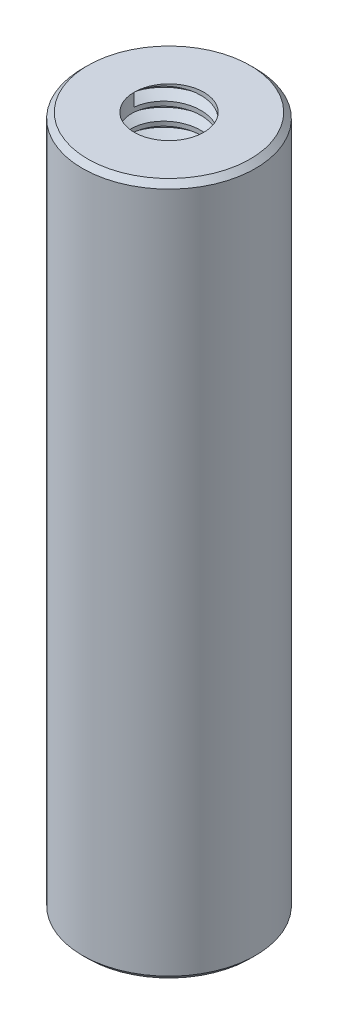
from build123d import *
from build123d.topology import SkipClean

# Parameters (mm, degrees)
CROQUIS2_R              = 6.35
SALIENTE_EXTRUIR1_DEPTH = 25.4
CHAFL_N1_SIZE           = 0.396875
TAP_START               = 25.4
CROQUIS3_R              = 2.5527
TAP_HOLE_1_DEPTH        = 19.05
TAP_START_2             = -6.35
CROQUIS3_2_R            = 2.5527
TAP_HOLE_2_DEPTH        = 19.05
ROSCA1_PITCH            = 1.27
ROSCA2_PITCH            = 1.27


with BuildPart() as part:
    # Croquis2 → Saliente-Extruir1 (new, symmetric)
    with BuildSketch(Plane(origin=(0, 0, 0), x_dir=(1, 0, 0), z_dir=(0, 1, 0))):
        with Locations(Location((0, 0, 0), (0, 0, 270))):
            Circle(CROQUIS2_R)
    extrude(amount=SALIENTE_EXTRUIR1_DEPTH, both=True)

    # Chaflán1
    chafl_n1_edges = [part.edges().sort_by_distance(p)[0] for p in [
        (0, -25.4, -6.35),
        (0, 25.4, -6.35),
    ]]
    chamfer(chafl_n1_edges, length=CHAFL_N1_SIZE)

    # Croquis3 → Tap Hole 1 (cut)
    with BuildSketch(Plane(origin=(0, 0, 0), x_dir=(1, 0, 0), z_dir=(0, 1, 0)).offset(TAP_START)):
        with Locations(Location((0, 0, 0), (0, 0, 270))):
            Circle(CROQUIS3_R)
    extrude(amount=-TAP_HOLE_1_DEPTH, mode=Mode.SUBTRACT)

    # Croquis3<2> → Tap Hole 2 (cut)
    with BuildSketch(Plane(origin=(0, 0, 0), x_dir=(1, 0, 0), z_dir=(0, 1, 0)).offset(TAP_START_2)):
        with Locations(Location((0, 0, 0), (0, 0, 270))):
            Circle(CROQUIS3_2_R)
    extrude(amount=-TAP_HOLE_2_DEPTH, mode=Mode.SUBTRACT)

    # Rosca1: the profile of Perfil de rosca1 profile screwed along a right-hand helix of 15 turns, 8 arcs to a turn; built about Z, then put on its axis
    with SkipClean():  # the faces are left unmerged after this step: merging them gives an invalid solid
        rosca1_z = Axis((0, 0, 0), (0, 0, 1))
        rosca1_corners = [(2.5524, 0, -0.000173205), (3.240107661, 0, 0.396874998), (3.240107661, 0, 0.555624998), (2.5524, 0, 0.952673202)]
        with BuildLine(mode=Mode.PRIVATE) as rosca1_profile:
            Line(rosca1_corners[0], rosca1_corners[1])
            Line(rosca1_corners[1], rosca1_corners[2])
            Line(rosca1_corners[2], rosca1_corners[3])
            Line(rosca1_corners[3], rosca1_corners[0])
        rosca1_cap = Face(rosca1_profile.wire())
        rosca1_turn_angles = [0, 22.5, 45, 67.5, 90, 112.5, 135, 157.5, 180, 202.5, 225, 247.5, 270, 292.5, 315, 337.5, 360]
        rosca1_turn_weights = [1, 0.9238795325112867, 1, 0.9238795325112867, 1, 0.9238795325112867, 1, 0.9238795325112867, 1, 0.9238795325112867, 1, 0.9238795325112867, 1, 0.9238795325112867, 1, 0.9238795325112867, 1]
        rosca1_turn_rails = [Edge.make_bspline([Vector(p[0], p[1], 0).rotate(rosca1_z, rosca1_turn_angles[k]) / rosca1_turn_weights[k] + Vector(0, 0, p[2] + ROSCA1_PITCH * rosca1_turn_angles[k] / 360) for k in range(17)], [0, 0, 0, 1, 1, 2, 2, 3, 3, 4, 4, 5, 5, 6, 6, 7, 7, 8, 8, 8], 2, rosca1_turn_weights) for p in rosca1_corners]
        rosca1_turn_sides = [Face.make_surface_from_curves(rosca1_turn_rails[p[0]], rosca1_turn_rails[p[1]]) for p in [(0, 1), (1, 2), (2, 3), (3, 0)]]
        rosca1 = Plane(origin=(0, 25.4, 0), x_dir=(-1, 0, 0), z_dir=(0, -1, 0)) * Solid(Shell([*[p.moved(Location((0, 0, ROSCA1_PITCH * i))) for i in range(15) for p in rosca1_turn_sides], rosca1_cap, rosca1_cap.rotate(rosca1_z, 5400).moved(Location((0, 0, ROSCA1_PITCH * 5400 / 360)))]))
        add(rosca1, mode=Mode.SUBTRACT)

    # Rosca2: the profile of Perfil de rosca2 profile screwed along a right-hand helix of 15 turns, 8 arcs to a turn; built about Z, then put on its axis
    with SkipClean():  # the faces are left unmerged after this step: merging them gives an invalid solid
        rosca2_z = Axis((0, 0, 0), (0, 0, 1))
        rosca2_corners = [(2.5524, 0, -0.000173205), (3.240107661, 0, 0.396874998), (3.240107661, 0, 0.555624998), (2.5524, 0, 0.952673202)]
        with BuildLine(mode=Mode.PRIVATE) as rosca2_profile:
            Line(rosca2_corners[0], rosca2_corners[1])
            Line(rosca2_corners[1], rosca2_corners[2])
            Line(rosca2_corners[2], rosca2_corners[3])
            Line(rosca2_corners[3], rosca2_corners[0])
        rosca2_cap = Face(rosca2_profile.wire())
        rosca2_turn_angles = [0, 22.5, 45, 67.5, 90, 112.5, 135, 157.5, 180, 202.5, 225, 247.5, 270, 292.5, 315, 337.5, 360]
        rosca2_turn_weights = [1, 0.9238795325112867, 1, 0.9238795325112867, 1, 0.9238795325112867, 1, 0.9238795325112867, 1, 0.9238795325112867, 1, 0.9238795325112867, 1, 0.9238795325112867, 1, 0.9238795325112867, 1]
        rosca2_turn_rails = [Edge.make_bspline([Vector(p[0], p[1], 0).rotate(rosca2_z, rosca2_turn_angles[k]) / rosca2_turn_weights[k] + Vector(0, 0, p[2] + ROSCA2_PITCH * rosca2_turn_angles[k] / 360) for k in range(17)], [0, 0, 0, 1, 1, 2, 2, 3, 3, 4, 4, 5, 5, 6, 6, 7, 7, 8, 8, 8], 2, rosca2_turn_weights) for p in rosca2_corners]
        rosca2_turn_sides = [Face.make_surface_from_curves(rosca2_turn_rails[p[0]], rosca2_turn_rails[p[1]]) for p in [(0, 1), (1, 2), (2, 3), (3, 0)]]
        rosca2 = Plane(origin=(0, -25.4, 0), x_dir=(1, 0, 0), z_dir=(0, 1, 0)) * Solid(Shell([*[p.moved(Location((0, 0, ROSCA2_PITCH * i))) for i in range(15) for p in rosca2_turn_sides], rosca2_cap, rosca2_cap.rotate(rosca2_z, 5400).moved(Location((0, 0, ROSCA2_PITCH * 5400 / 360)))]))
        add(rosca2, mode=Mode.SUBTRACT)


solid = part.part
